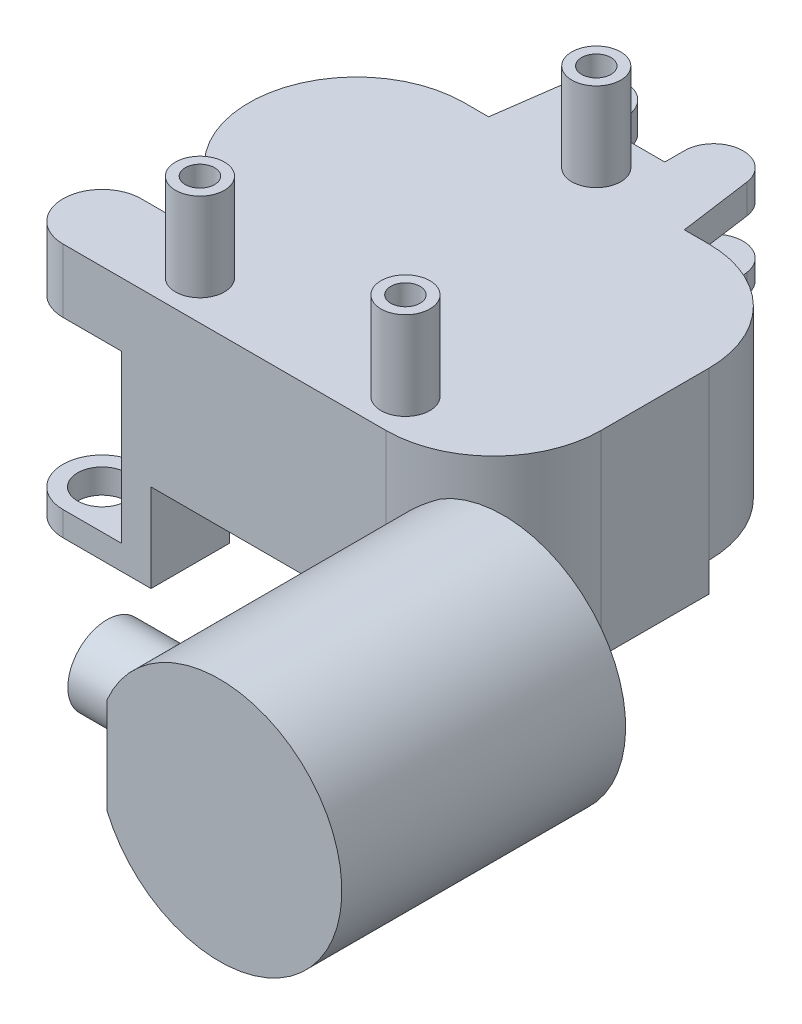
from build123d import *

# Parameters (mm, degrees)
BOSS_EXTRUDE1_DEPTH = 17
BOSS_EXTRUDE2_DEPTH = 10
BOSS_EXTRUDE3_DEPTH = 29
SKETCH6_R           = 4
BOSS_EXTRUDE4_DEPTH = 8
BOSS_EXTRUDE5_DEPTH = 26
SKETCH11_R          = 2.5
BOSS_EXTRUDE6_DEPTH = 9
BOSS_EXTRUDE8_START = 3
BOSS_EXTRUDE8_DEPTH = 3
CUT_EXTRUDE1_DEPTH  = 3
BOSS_EXTRUDE7_START = 2
SKETCH12_R          = 5
BOSS_EXTRUDE7_DEPTH = 5
BOSS_EXTRUDE7_TAPER = -45
SKETCH10_W          = 10
SKETCH10_H          = 17
CUT_EXTRUDE2_DEPTH  = 9.2
CUT_EXTRUDE3_START  = -13.5
SKETCH14_W          = 25
SKETCH14_H          = 5
CUT_EXTRUDE3_DEPTH  = 57.929042368
SKETCH15_R          = 2.5
CUT_EXTRUDE4_DEPTH  = 8
SKETCH16_R          = 1.5
CUT_EXTRUDE5_DEPTH  = 6
SKETCH17_R          = 2.5
CUT_EXTRUDE6_DEPTH  = 21.5
FILLET1_R           = 6


with BuildPart() as part:
    # Sketch1 → Boss-Extrude1 (new body)
    with BuildSketch(Plane(origin=(0, 0, 0), x_dir=(1, 0, 0), z_dir=(0, 1, 0))):
        with BuildLine():
            Line((-11, 16.5), (-36, 16.5))
            ThreePointArc((-36, 16.5), (-46.695268783, 8.071230378), (-41, -4.297958971))
            Line((-41, -4.297958971), (-41, -16.5))
            Line((-41, -16.5), (-11, -16.5))
            ThreePointArc((-11, -16.5), (-3.221825407, -13.278174593), (0, -5.5))
            Line((0, -5.5), (0, 5.5))
            ThreePointArc((0, 5.5), (-3.221825407, 13.278174593), (-11, 16.5))
        make_face()
    extrude(amount=BOSS_EXTRUDE1_DEPTH)

    # Sketch2 → Boss-Extrude2 (add)
    with BuildSketch(Plane(origin=(0, 17, 0), x_dir=(1, 0, 0), z_dir=(0, 1, 0))):
        with BuildLine():
            Line((-33.5, 16.5), (-32.471532465, 23.912304266))
            ThreePointArc((-32.471532465, 23.912304266), (-29.293357066, 26.492874655), (-26.5, 23.5))
            Line((-26.5, 23.5), (-26.5, 21.5))
            Line((-26.5, 21.5), (-20.5, 21.5))
            Line((-20.5, 21.5), (-20.5, 23.5))
            ThreePointArc((-20.5, 23.5), (-17.706642934, 26.492874655), (-14.528467535, 23.912304266))
            Line((-14.528467535, 23.912304266), (-13.5, 16.5))
            Line((-13.5, 16.5), (-33.5, 16.5))
        make_face()
    extrude(amount=-BOSS_EXTRUDE2_DEPTH)

    # Sketch5 → Boss-Extrude3 (add)
    with BuildSketch(Plane.XY.offset(44.5)):
        with BuildLine():
            Line((-11.5, 6.898979486), (-11.5, -2.898979486))
            ThreePointArc((-11.5, -2.898979486), (12.5, 2), (-11.5, 6.898979486))
        make_face()
    extrude(amount=-BOSS_EXTRUDE3_DEPTH)

    # Sketch6 → Boss-Extrude4 (add)
    with BuildSketch(Plane.ZY.offset(11.5)):
        with Locations(Location((36.5, 2, 0), (0, 0, 270))):
            Circle(SKETCH6_R)
    extrude(amount=BOSS_EXTRUDE4_DEPTH)

    # Sketch7 → Boss-Extrude5 (add)
    with BuildSketch(Plane(origin=(0, 17, 0), x_dir=(1, 0, 0), z_dir=(0, 1, 0))):
        with BuildLine():
            Line((-44, -8.5), (-35, -8.5))
            Line((-35, -8.5), (-35, -16.5))
            Line((-35, -16.5), (-44, -16.5))
            ThreePointArc((-44, -16.5), (-48, -12.5), (-44, -8.5))
        make_face()
    extrude(amount=-BOSS_EXTRUDE5_DEPTH)

    # Sketch11 → Boss-Extrude6 (add)
    with BuildSketch(Plane(origin=(0, 17, 0), x_dir=(1, 0, 0), z_dir=(0, 1, 0))):
        with Locations(Location((-23.5, 17.5, 0), (0, 0, 270))):
            Circle(SKETCH11_R)
        with Locations(Location((-34, -12.5, 0), (0, 0, 270))):
            Circle(SKETCH11_R)
        with Locations(Location((-13, -12.5, 0), (0, 0, 270))):
            Circle(SKETCH11_R)
    extrude(amount=BOSS_EXTRUDE6_DEPTH)

    # Sketch13 → Boss-Extrude8 (add)
    with BuildSketch(Plane.XZ.offset(BOSS_EXTRUDE8_START)):
        with BuildLine():
            Line((-11, -5.5), (0, -5.5))
            Line((0, -5.5), (0, 5.5))
            ThreePointArc((0, 5.5), (-18.778174593, 13.278174593), (-11, -5.5))
        make_face()
    extrude(amount=-BOSS_EXTRUDE8_DEPTH)

    # Sketch9 → Cut-Extrude1 (cut)
    with BuildSketch(Plane.XZ):
        with BuildLine():
            Line((-25, -16.5), (-25, -5.5))
            ThreePointArc((-25, -5.5), (-43.778174593, 2.278174593), (-36, -16.5))
            Line((-36, -16.5), (-25, -16.5))
        make_face()
    extrude(amount=-CUT_EXTRUDE1_DEPTH, mode=Mode.SUBTRACT)

    # Sketch12 → Boss-Extrude7 (add)
    with BuildSketch(Plane.XZ.offset(BOSS_EXTRUDE7_START)):
        with Locations((-36, -5.5)):
            Circle(SKETCH12_R)
    extrude(amount=-BOSS_EXTRUDE7_DEPTH, taper=BOSS_EXTRUDE7_TAPER)

    # Sketch10 → Cut-Extrude2 (cut)
    with BuildSketch(Plane.XY.offset(16.5)):
        with Locations((-43, 2)):
            Rectangle(SKETCH10_W, SKETCH10_H)
    extrude(amount=-CUT_EXTRUDE2_DEPTH, mode=Mode.SUBTRACT)

    # Sketch14 → Cut-Extrude3 (cut, through all)
    with BuildSketch(Plane(origin=(0, 0, 0), x_dir=(0, 0, -1), z_dir=(1, 0, 0)).offset(CUT_EXTRUDE3_START)):
        with Locations((14, 11.5)):
            Rectangle(SKETCH14_W, SKETCH14_H)
    extrude(amount=-CUT_EXTRUDE3_DEPTH, mode=Mode.SUBTRACT)

    # Sketch15 → Cut-Extrude4 (cut)
    with BuildSketch(Plane.ZY.offset(19.5)):
        with Locations(Location((36.5, 2, 0), (0, 0, 270))):
            Circle(SKETCH15_R)
    extrude(amount=-CUT_EXTRUDE4_DEPTH, mode=Mode.SUBTRACT)

    # Sketch16 → Cut-Extrude5 (cut)
    with BuildSketch(Plane(origin=(0, 26, 0), x_dir=(1, 0, 0), z_dir=(0, 1, 0))):
        with Locations(Location((-23.5, 17.5, 0), (0, 0, 270))):
            Circle(SKETCH16_R)
        with Locations(Location((-34, -12.5, 0), (0, 0, 270))):
            Circle(SKETCH16_R)
        with Locations(Location((-13, -12.5, 0), (0, 0, 270))):
            Circle(SKETCH16_R)
    extrude(amount=-CUT_EXTRUDE5_DEPTH, mode=Mode.SUBTRACT)

    # Sketch17 → Cut-Extrude6 (cut)
    with BuildSketch(Plane.XZ.offset(9)):
        with Locations(Location((-44, 12.5, 0), (0, 0, 270))):
            Circle(SKETCH17_R)
    extrude(amount=-CUT_EXTRUDE6_DEPTH, mode=Mode.SUBTRACT)

    # Fillet1
    # the kernel refuses this fillet: 6 mm, written as the material it adds along each edge
    with BuildSketch(Plane(origin=(-38, 10.5, 7.3), x_dir=(0, 0, 1), z_dir=(0, -1, 0))) as fillet1_piece_1_section:
        with BuildLine():
            CenterArc((5.196152423, 6), FILLET1_R, 210, 60)
            Line((0, 3), (0, 0))
            Line((0, 0), (5.196152423, 0))
        make_face()
    fillet1_piece_1 = extrude(amount=23.490381057, mode=Mode.PRIVATE)
    fillet1_piece_1 = split(fillet1_piece_1, bisect_by=Plane(origin=(-38.38283384, 5.25, 8.5), z_dir=(0, 0, 1)), keep=Keep.TOP, mode=Mode.PRIVATE)
    fillet1_piece_1 = split(fillet1_piece_1, bisect_by=Plane(origin=(-38.38283384, -9, 10.353353241), z_dir=(0, 1, 0)), keep=Keep.TOP, mode=Mode.PRIVATE)
    add(fillet1_piece_1)
    with BuildSketch(Plane(origin=(-38, 10.5, 7.3), x_dir=(0, 0, 1), z_dir=(0, -1, 0))) as fillet1_piece_2:
        with BuildLine():
            CenterArc((5.196152423, 6), FILLET1_R, 210, 60)
            Line((0, 3), (0, 0))
            Line((0, 0), (5.196152423, 0))
        make_face()
    extrude(amount=10.5)


solid = part.part
